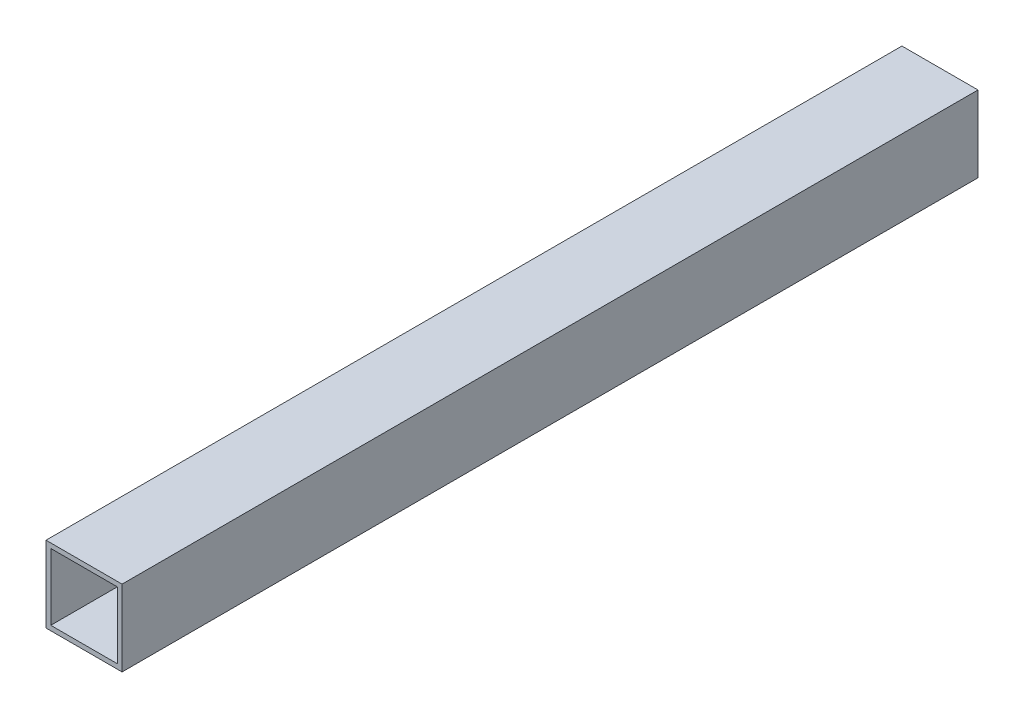
from build123d import *

# Parameters (mm, degrees)
SKETCH1_W           = 40
SKETCH1_H           = 40
SKETCH1_W_2         = 35
SKETCH1_H_2         = 35
BOSS_EXTRUDE1_DEPTH = 225


with BuildPart() as part:
    # Sketch1 → Boss-Extrude1 (new, symmetric)
    with BuildSketch(Plane.XY):
        Rectangle(SKETCH1_W, SKETCH1_H)
        Rectangle(SKETCH1_W_2, SKETCH1_H_2, mode=Mode.SUBTRACT)
    extrude(amount=BOSS_EXTRUDE1_DEPTH, both=True)


solid = part.part
